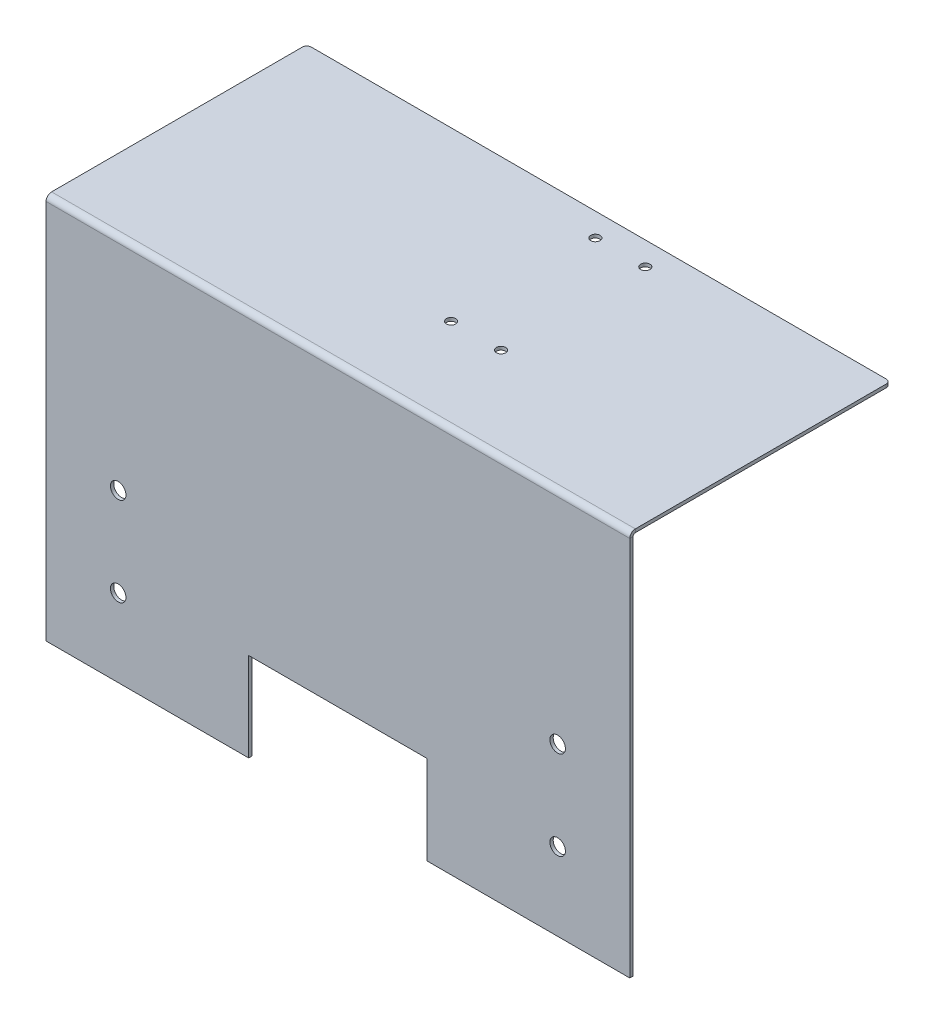
from build123d import *

# Parameters (mm, degrees)
SM_BASE_FLANGE_1_DEPTH = 131.5
HOLE_WIZARD_M6_1_D     = 7
SKETCH_6_W             = 80.4
SKETCH_6_H             = 40
CUT_EXTRUDE_1_DEPTH    = 248.738773711
HOLE_WIZARD_M5_1_D     = 4.2
OTHER_START            = 172.5
OTHER_1_DEPTH          = 1.5


# Read off the part's stored shape, not the designer's step: 断开-边角1
# Sheet-metal steps are written as plain solids
with BuildPart() as part:
    # Sketch 1 → 基体-法兰1 (new, symmetric)
    with BuildSketch(Plane(origin=(0, 0, 0), x_dir=(0, 0, -1), z_dir=(1, 0, 0))):
        with BuildLine():
            Line((0, 0), (0, 171.5))
            ThreePointArc((0, 171.5), (0.732233047, 173.267766953), (2.5, 174))
            Line((2.5, 174), (117.5, 174))
            Line((117.5, 174), (117.5, 172.5))
            Line((117.5, 172.5), (2.5, 172.5))
            ThreePointArc((2.5, 172.5), (1.792893219, 172.207106781), (1.5, 171.5))
            Line((1.5, 171.5), (1.5, 0))
            Line((1.5, 0), (0, 0))
        make_face()
    extrude(amount=SM_BASE_FLANGE_1_DEPTH, both=True)

    # M6 间隙孔1 (through all)
    with Locations(Plane(origin=(0, 0, -1.5), x_dir=(-1, 0, 0), z_dir=(0, 0, -1))):
        with Locations((-99, 75), (-99, 35), (99, 35), (99, 75)):
            Hole(HOLE_WIZARD_M6_1_D / 2)

    # 草图6 → 切除-拉伸1 (cut, through all)
    with BuildSketch(Plane.XY):
        with Locations((0, 20)):
            Rectangle(SKETCH_6_W, SKETCH_6_H)
    extrude(amount=-CUT_EXTRUDE_1_DEPTH, mode=Mode.SUBTRACT)

    # M5 螺纹孔1 (through all)
    with Locations(Plane(origin=(0, 174, 0), x_dir=(1, 0, 0), z_dir=(0, 1, 0))):
        with Locations((9, 107), (31.5, 107), (31.5, 42), (9, 42)):
            Hole(HOLE_WIZARD_M5_1_D / 2)

    # Other 1 outline → Other 1 (cut)
    with BuildSketch(Plane(origin=(0, 0, 0), x_dir=(1, 0, 0), z_dir=(0, 1, 0)).offset(OTHER_START)):
        with BuildLine():
            Line((131.5, 117.5), (129.5, 117.5))
            ThreePointArc((129.5, 117.5), (130.914213562, 116.914213562), (131.5, 115.5))
            Line((131.5, 115.5), (131.5, 117.5))
        make_face()
        with BuildLine():
            ThreePointArc((-131.5, 115.5), (-130.914213562, 116.914213562), (-129.5, 117.5))
            Line((-129.5, 117.5), (-131.5, 117.5))
            Line((-131.5, 117.5), (-131.5, 115.5))
        make_face()
    extrude(amount=OTHER_1_DEPTH, mode=Mode.SUBTRACT)


solid = part.part
